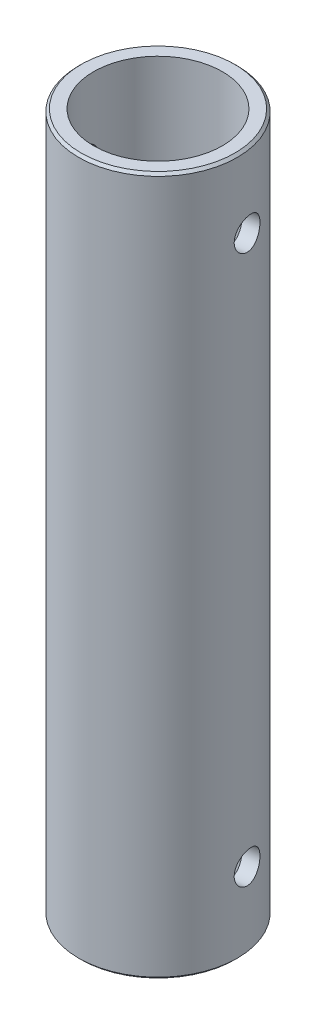
from build123d import *

# Parameters (mm, degrees)
SKETCH1_R               = 7.94
SKETCH1_R_2             = 6.44
BOSS_EXTRUDE1_DEPTH     = 69.91
CHAMFER1_SIZE           = 0.25
CUT_EXTRUDE1_DEPTH      = 72.791687092
CUT_EXTRUDE1_DEPTH_BACK = 72.791687092
SKETCH2_R               = 1.55
CUT_EXTRUDE2_DEPTH      = 72.791687221
CUT_EXTRUDE2_DEPTH_BACK = 72.791687221
SKETCH3_R               = 1.55


with BuildPart() as part:
    # Sketch1 → Boss-Extrude1 (new body)
    with BuildSketch(Plane(origin=(0, 0, 0), x_dir=(1, 0, 0), z_dir=(0, 1, 0))):
        Circle(SKETCH1_R)
        Circle(SKETCH1_R_2, mode=Mode.SUBTRACT)
    extrude(amount=BOSS_EXTRUDE1_DEPTH)

    # Chamfer1
    chamfer1_edges = [part.edges().sort_by_distance(p)[0] for p in [
        (-7.94, 0, 0),
        (-7.94, 69.91, 0),
    ]]
    chamfer(chamfer1_edges, length=CHAMFER1_SIZE)

    # Sketch2 → Cut-Extrude1 (cut, two sides: drawn at the far end of the back side and taken through both)
    with BuildSketch(Plane(origin=(-5.777480216, 0, 0.918271394), x_dir=(0.1569694691400111, 0, 0.9876034557239576), z_dir=(-0.9876034557239577, 0, 0.15696946914001111)).offset(-CUT_EXTRUDE1_DEPTH_BACK)):
        with Locations((0, 7.5)):
            Circle(SKETCH2_R)
    extrude(amount=CUT_EXTRUDE1_DEPTH + CUT_EXTRUDE1_DEPTH_BACK, mode=Mode.SUBTRACT)

    # Sketch3 → Cut-Extrude2 (cut, two sides: drawn at the far end of the back side and taken through both)
    with BuildSketch(Plane(origin=(-5.777480216, 0, 0.918271394), x_dir=(0.15696946914000962, 0, 0.9876034557239578), z_dir=(-0.9876034557239578, 0, 0.15696946914000962)).offset(-CUT_EXTRUDE2_DEPTH_BACK)):
        with Locations((0, 62.41)):
            Circle(SKETCH3_R)
    extrude(amount=CUT_EXTRUDE2_DEPTH + CUT_EXTRUDE2_DEPTH_BACK, mode=Mode.SUBTRACT)


solid = part.part
